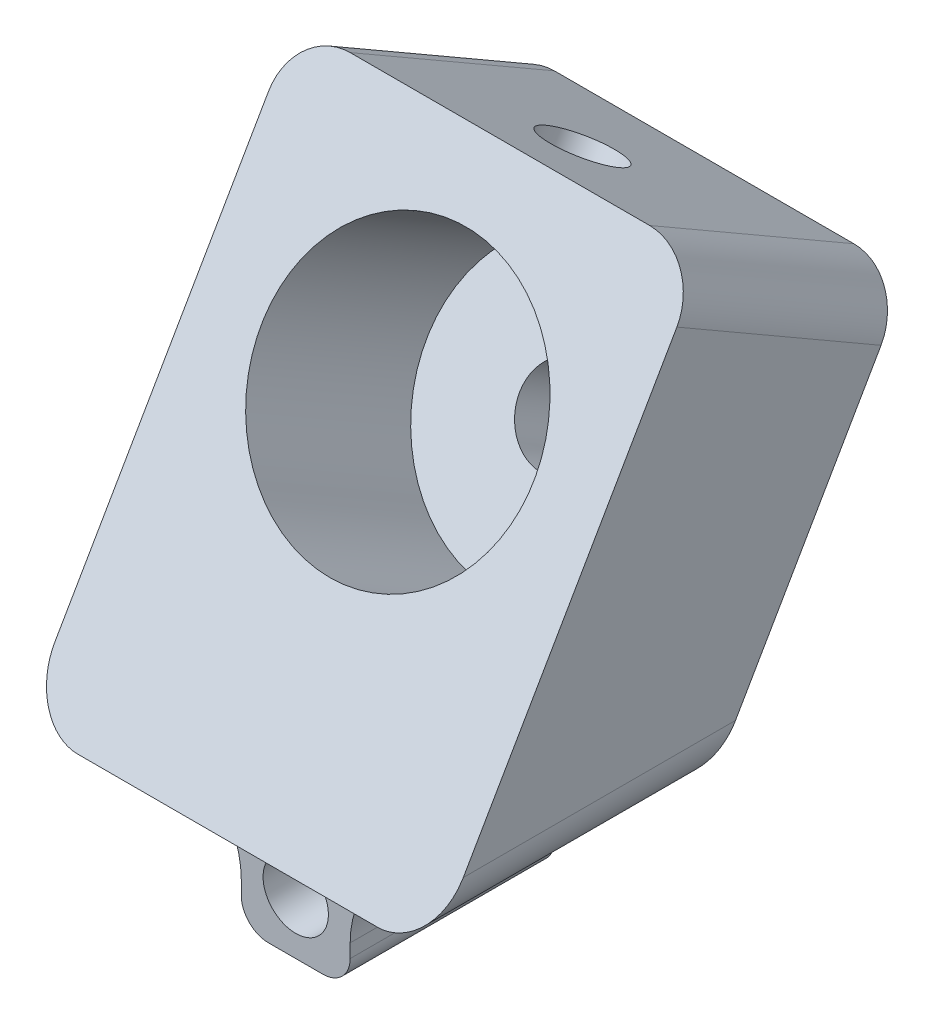
from build123d import *

# Parameters (mm, degrees)
SKETCH1_W            = 4
SKETCH1_H            = 5
BOSS_EXTRUDE1_DEPTH  = 3.75
SKETCH2_W            = 3.1
SKETCH2_H            = 3.1
CUT_EXTRUDE1_DEPTH   = 5
BOSS_EXTRUDE2_DEPTH  = 7.5
M2_CLEARANCE_HOLE1_D = 2.4
FILLET1_R            = 3.5
FILLET2_R            = 2
FILLET3_R            = 1
SKETCH17_R           = 5
CUT_EXTRUDE2_DEPTH   = 7
SKETCH5_R            = 1.5875
CUT_EXTRUDE3_DEPTH   = 5
FILLET4_R            = 1
SKETCH18_R           = 1.35
CUT_EXTRUDE4_DEPTH   = 5


with BuildPart() as part:
    # Sketch1 → Boss-Extrude1 (new, symmetric)
    with BuildSketch(Plane.XY):
        Rectangle(SKETCH1_W, SKETCH1_H)
    extrude(amount=BOSS_EXTRUDE1_DEPTH, both=True)

    # Sketch2 → Cut-Extrude1 (cut)
    with BuildSketch(Plane(origin=(0, 0, -3.75), x_dir=(-1, 0, 0), z_dir=(0, 0, -1))):
        with Locations((0, -0.55)):
            Rectangle(SKETCH2_W, SKETCH2_H)
    extrude(amount=-CUT_EXTRUDE1_DEPTH, mode=Mode.SUBTRACT)

    # Sketch3 → Boss-Extrude2 (add, symmetric)
    with BuildSketch(Plane(origin=(0, 0, 0), x_dir=(0, 0, -1), z_dir=(1, 0, 0))):
        Polygon((-6.25, 2.5), (3.75, 19.820508076), (11.25, 15.490381057), (3.75, 2.5), align=None)
    extrude(amount=BOSS_EXTRUDE2_DEPTH, both=True)

    # M2 Clearance Hole1 (through all)
    with Locations(Plane.XY.offset(3.75)):
        with Locations((0, -0.5)):
            Hole(M2_CLEARANCE_HOLE1_D / 2)

    # Fillet1
    fillet1_edges = [part.edges().sort_by_distance(p)[0] for p in [
        (-2, 2.5, 0),
        (2, 2.5, 0),
    ]]
    fillet(fillet1_edges, radius=FILLET1_R)

    # Fillet2
    fillet2_edges = [part.edges().sort_by_distance(p)[0] for p in [
        (-7.5, 17.655444566, -7.5),
        (7.5, 17.655444566, -7.5),
        (7.5, 2.5, 1.25),
        (-7.5, 2.5, 1.25),
    ]]
    fillet(fillet2_edges, radius=FILLET2_R - 0.0001)  # a hair under: the kernel refuses the full size

    # Fillet3
    fillet3_edges = [part.edges().sort_by_distance(p)[0] for p in [
        (2, -2.5, 0),
        (-2, -2.5, 0),
    ]]
    fillet(fillet3_edges, radius=FILLET3_R)

    # Sketch17 → Cut-Extrude2 (cut)
    with BuildSketch(Plane(origin=(0, 3.331329387, 5.770031755), x_dir=(1, 0, 0), z_dir=(0, 0.5000000000000039, 0.8660254037844365))):
        with Locations(Location((0, 11.540063509, 0), (0, 0, 270))):
            Circle(SKETCH17_R)
    extrude(amount=-CUT_EXTRUDE2_DEPTH, mode=Mode.SUBTRACT)

    # Sketch5 → Cut-Extrude3 (cut)
    with BuildSketch(Plane(origin=(0, -0.998797632, -1.729968245), x_dir=(-1, 0, 0), z_dir=(0, -0.5000000000000038, -0.8660254037844366))):
        with Locations(Location((0, 11.540063509, 0), (0, 0, 90))):
            Circle(SKETCH5_R)
    extrude(amount=-CUT_EXTRUDE3_DEPTH, mode=Mode.SUBTRACT)

    # Fillet4
    fillet4_edges = [part.edges().sort_by_distance(p)[0] for p in [
        (0, 2.5, 3.75),
    ]]
    fillet(fillet4_edges, radius=FILLET4_R)

    # Sketch18 → Cut-Extrude4 (cut)
    with BuildSketch(Plane(origin=(0, 16.489178689, -9.520031755), x_dir=(1, 0, 0), z_dir=(0, 0.8660254037844366, -0.5000000000000038))):
        with Locations(Location((0, -3.162658774, 0), (0, 0, 270))):
            Circle(SKETCH18_R)
    extrude(amount=-CUT_EXTRUDE4_DEPTH, mode=Mode.SUBTRACT)


solid = part.part
